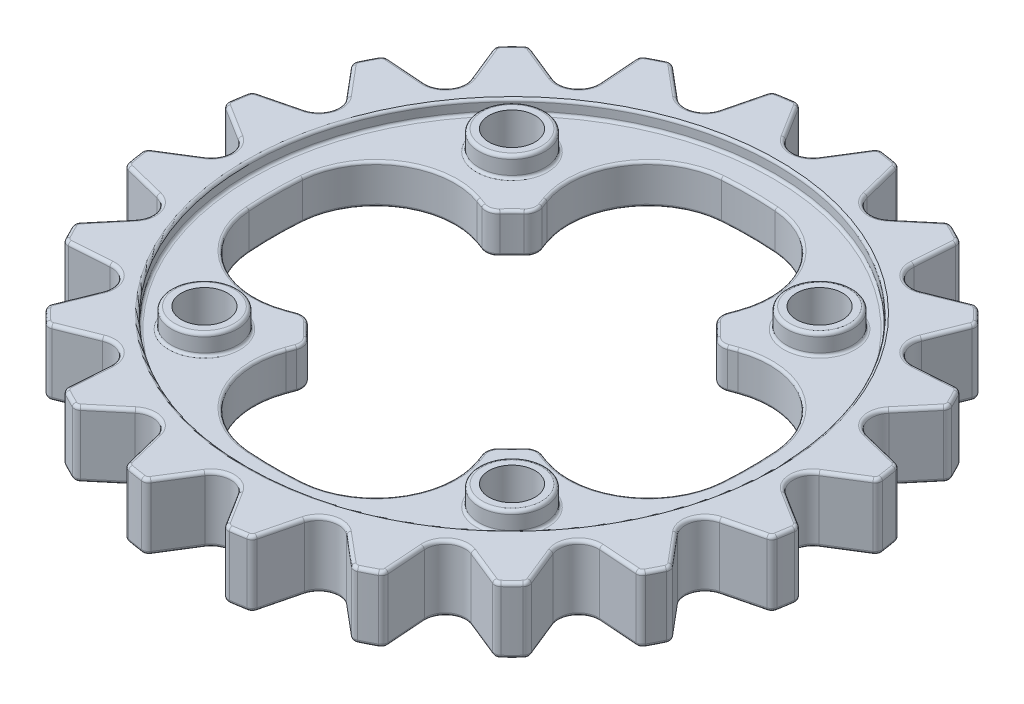
from build123d import *

# Parameters (mm, degrees)
SKETCH_1_W                       = 50
SKETCH_1_H                       = 10
CUT_REVOLVE_START                = -5
CUT_REVOLVE_1_DEPTH              = 10
FILLET_1_R                       = 1
FILLET_2_R                       = 3
PATTERN_CIRCULAR_1_COUNT         = 20
FILLET_1_OF_PATTERN_CIRCULAR_1_R = 1
FILLET_2_OF_PATTERN_CIRCULAR_1_R = 3
CUT_REVOLVE_2_DEPTH              = 10
FILLET_4_R                       = 12
PATTERN_CIRCULAR_2_COUNT         = 4
FILLET_4_OF_PATTERN_CIRCULAR_2_R = 12
SKETCH_5_W                       = 22
SKETCH_5_H                       = 10
SKETCH_8_W                       = 40
SKETCH_8_H                       = 4
SKETCH_6_W                       = 5
SKETCH_6_H                       = 12
SKETCH_7_W                       = 3.5
SKETCH_7_H                       = 12
PATTERN_CIRCULAR_3_COUNT         = 4
FILLET_5_R                       = 2
FILLET_7_R                       = 0.5
FILLET_8_R                       = 0.4


# Read off the part's stored shape, not the designer's step: Вырез-Повернуть1, Вырез-Повернуть2
with BuildPart() as part:
    # Эскиз1 → Повернуть1 (revolve)
    with BuildSketch(Plane.XY, mode=Mode.PRIVATE) as revolve_1_sk:
        with Locations((25, 0)):
            Rectangle(SKETCH_1_W, SKETCH_1_H)
    revolve(revolve_1_sk.sketch.rotate(Axis((0, -5, 0), (0, 1, 0)), 90), axis=Axis((0, -5, 0), (0, 1, 0)))

    # Вырез-Повернуть1 outline → Вырез-Повернуть1 (cut)
    with BuildSketch(Plane(origin=(0, 0, 0), x_dir=(1, 0, 0), z_dir=(0, 1, 0)).offset(CUT_REVOLVE_START)):
        with BuildLine():
            Line((-49.63611386, -6.021312223), (-40, 0))
            Line((-40, 0), (-49.63611386, 6.021312223))
            ThreePointArc((-49.63611386, 6.021312223), (-50, 0), (-49.63611386, -6.021312223))
        make_face()
    cut_revolve_1 = extrude(amount=CUT_REVOLVE_1_DEPTH, mode=Mode.SUBTRACT)

    # Скругление1
    fillet_1_edges = [part.edges().sort_by_distance(p)[0] for p in [
        (-49.63611386, 0, -6.021312223),
        (-49.63611386, 0, 6.021312223),
    ]]
    fillet(fillet_1_edges, radius=FILLET_1_R)

    # Скругление2
    fillet_2_edges = [part.edges().sort_by_distance(p)[0] for p in [
        (-40, 0, 0),
    ]]
    fillet(fillet_2_edges, radius=FILLET_2_R)

    # Круговой массив1: Вырез-Повернуть1 ×20 about axis
    pattern_circular_1_axis = Axis((0, 0, 0), (0, 1, 0))
    for i in range(1, PATTERN_CIRCULAR_1_COUNT):
        add(cut_revolve_1.rotate(pattern_circular_1_axis, i * 360 / PATTERN_CIRCULAR_1_COUNT), mode=Mode.SUBTRACT)

    # Скругление1 of Круговой массив1
    fillet_1_of_pattern_circular_1_edges = [part.edges().sort_by_distance(p)[0] for p in [
        (-49.067437335, 0, 9.611794491),
        (-45.346061725, 0, 21.065010944),
        (-43.695698172, 0, 24.304031791),
        (-36.617221123, 0, 34.046719625),
        (-34.046719625, 0, 36.617221123),
        (-24.304031791, 0, 43.695698172),
        (-21.065010944, 0, 45.346061725),
        (-9.611794491, 0, 49.067437335),
        (-6.021312223, 0, 49.63611386),
        (6.021312223, 0, 49.63611386),
        (9.611794491, 0, 49.067437335),
        (21.065010944, 0, 45.346061725),
        (24.304031791, 0, 43.695698172),
        (34.046719625, 0, 36.617221123),
        (36.617221123, 0, 34.046719625),
        (43.695698172, 0, 24.304031791),
        (45.346061725, 0, 21.065010944),
        (49.067437335, 0, 9.611794491),
        (49.63611386, 0, 6.021312223),
        (49.63611386, 0, -6.021312223),
        (49.067437335, 0, -9.611794491),
        (45.346061725, 0, -21.065010944),
        (43.695698172, 0, -24.304031791),
        (36.617221123, 0, -34.046719625),
        (34.046719625, 0, -36.617221123),
        (24.304031791, 0, -43.695698172),
        (21.065010944, 0, -45.346061725),
        (9.611794491, 0, -49.067437335),
        (6.021312223, 0, -49.63611386),
        (-6.021312223, 0, -49.63611386),
        (-9.611794491, 0, -49.067437335),
        (-21.065010944, 0, -45.346061725),
        (-24.304031791, 0, -43.695698172),
        (-34.046719625, 0, -36.617221123),
        (-36.617221123, 0, -34.046719625),
        (-43.695698172, 0, -24.304031791),
        (-45.346061725, 0, -21.065010944),
        (-49.067437335, 0, -9.611794491),
    ]]
    fillet(fillet_1_of_pattern_circular_1_edges, radius=FILLET_1_OF_PATTERN_CIRCULAR_1_R)

    # Скругление2 of Круговой массив1
    fillet_2_of_pattern_circular_1_edges = [part.edges().sort_by_distance(p)[0] for p in [
        (-38.042260652, 0, 12.360679775),
        (-32.360679775, 0, 23.511410092),
        (-23.511410092, 0, 32.360679775),
        (-12.360679775, 0, 38.042260652),
        (0, 0, 40),
        (12.360679775, 0, 38.042260652),
        (23.511410092, 0, 32.360679775),
        (32.360679775, 0, 23.511410092),
        (38.042260652, 0, 12.360679775),
        (40, 0, 0),
        (38.042260652, 0, -12.360679775),
        (32.360679775, 0, -23.511410092),
        (23.511410092, 0, -32.360679775),
        (12.360679775, 0, -38.042260652),
        (0, 0, -40),
        (-12.360679775, 0, -38.042260652),
        (-23.511410092, 0, -32.360679775),
        (-32.360679775, 0, -23.511410092),
        (-38.042260652, 0, -12.360679775),
    ]]
    fillet(fillet_2_of_pattern_circular_1_edges, radius=FILLET_2_OF_PATTERN_CIRCULAR_1_R)

    # Вырез-Повернуть2 outline → Вырез-Повернуть2 (cut)
    with BuildSketch(Plane(origin=(0, 0, 0), x_dir=(1, 0, 0), z_dir=(0, 1, 0)).offset(CUT_REVOLVE_START)):
        with BuildLine():
            Line((20, 0), (-32.622786764, 19.153128026))
            ThreePointArc((-32.622786764, 19.153128026), (-36, 0), (-32.622786764, -19.153128026))
            Line((-32.622786764, -19.153128026), (20, 0))
        make_face()
    cut_revolve_2 = extrude(amount=CUT_REVOLVE_2_DEPTH, mode=Mode.SUBTRACT)

    # Скругление4
    fillet_4_edges = [part.edges().sort_by_distance(p)[0] for p in [
        (-32.622786764, 0, -19.153128026),
        (-32.622786764, 0, 19.153128026),
    ]]
    fillet(fillet_4_edges, radius=FILLET_4_R)

    # Круговой массив2: Вырез-Повернуть2 ×4 about axis
    pattern_circular_2_axis = Axis((0, 0, 0), (0, 1, 0))
    for i in range(1, PATTERN_CIRCULAR_2_COUNT):
        add(cut_revolve_2.rotate(pattern_circular_2_axis, i * 360 / PATTERN_CIRCULAR_2_COUNT), mode=Mode.SUBTRACT)

    # Скругление4 of Круговой массив2
    fillet_4_of_pattern_circular_2_edges = [part.edges().sort_by_distance(p)[0] for p in [
        (-19.153128026, 0, 32.622786764),
        (19.153128026, 0, 32.622786764),
        (32.622786764, 0, 19.153128026),
        (32.622786764, 0, -19.153128026),
        (19.153128026, 0, -32.622786764),
        (-19.153128026, 0, -32.622786764),
    ]]
    fillet(fillet_4_of_pattern_circular_2_edges, radius=FILLET_4_OF_PATTERN_CIRCULAR_2_R)

    # Эскиз5 → Вырез-Повернуть3 (revolve, cut)
    with BuildSketch(Plane.XY):
        with Locations((11, 0)):
            Rectangle(SKETCH_5_W, SKETCH_5_H)
    revolve(axis=Axis((0, 5, 0), (0, -1, 0)), mode=Mode.SUBTRACT)

    # Эскиз8 → Вырез-Повернуть5 (revolve, cut)
    with BuildSketch(Plane.XY):
        with Locations((-20, 5)):
            Rectangle(SKETCH_8_W, SKETCH_8_H)
    cut_revolve_5 = revolve(axis=Axis((0, 7, 0), (0, -1, 0)), mode=Mode.SUBTRACT)

    # Зеркальное отражение1: Вырез-Повернуть5 across plane
    add(cut_revolve_5.mirror(Plane.ZX), mode=Mode.SUBTRACT)

    # Эскиз6 → Повернуть2 (revolve)
    with BuildSketch(Plane(origin=(0, 0, 0), x_dir=(0.7071067811865488, 0, -0.7071067811865464), z_dir=(0.7071067811865464, 0, 0.7071067811865488)), mode=Mode.PRIVATE) as revolve_2_sk:
        with Locations((35.5, 0)):
            Rectangle(SKETCH_6_W, SKETCH_6_H)
    revolve_2 = revolve(revolve_2_sk.sketch.rotate(Axis((23.334523779, -6, -23.334523779), (0, 1, 0)), 45), axis=Axis((23.334523779, -6, -23.334523779), (0, 1, 0)))

    # Эскиз7 → Вырез-Повернуть4 (revolve, cut)
    with BuildSketch(Plane(origin=(0, 0, 0), x_dir=(0.7071067811865488, 0, -0.7071067811865464), z_dir=(0.7071067811865464, 0, 0.7071067811865488)), mode=Mode.PRIVATE) as cut_revolve_4_sk:
        with Locations((34.75, 0)):
            Rectangle(SKETCH_7_W, SKETCH_7_H)
    cut_revolve_4 = revolve(cut_revolve_4_sk.sketch.rotate(Axis((23.334523779, 6, -23.334523779), (0, -1, 0)), 135), axis=Axis((23.334523779, 6, -23.334523779), (0, -1, 0)), mode=Mode.SUBTRACT)

    # Круговой массив3: Повернуть2, Вырез-Повернуть4 ×4 about axis
    pattern_circular_3_axis = Axis((0, 0, 0), (0, 1, 0))
    add([revolve_2.rotate(pattern_circular_3_axis, i * 360 / PATTERN_CIRCULAR_3_COUNT) for i in range(1, PATTERN_CIRCULAR_3_COUNT)])
    add([cut_revolve_4.rotate(pattern_circular_3_axis, i * 360 / PATTERN_CIRCULAR_3_COUNT) for i in range(1, PATTERN_CIRCULAR_3_COUNT)], mode=Mode.SUBTRACT)

    # Скругление5
    fillet_5_edges = [part.edges().sort_by_distance(p)[0] for p in [
        (-17.308985449, 0, -13.579360174),
        (-13.579360174, 0, -17.308985449),
        (13.579360174, 0, -17.308985449),
        (17.308985449, 0, -13.579360174),
        (-13.579360174, 0, 17.308985449),
        (-17.308985449, 0, 13.579360174),
        (17.308985449, 0, 13.579360174),
        (13.579360174, 0, 17.308985449),
    ]]
    fillet(fillet_5_edges, radius=FILLET_5_R)

    # Скругление7
    fillet_7_edges = [part.edges().sort_by_distance(p)[0] for p in [
        (-49.38441703, 5, -7.821723252),
        (-49.38441703, -5, -7.821723252),
        (-46.582176788, -5, 4.113000544),
        (-46.582176788, -5, -4.113000544),
        (-49.467995586, -5, -6.104585297),
        (-49.467995586, -5, 6.104585297),
        (-49.467995586, 5, -6.104585297),
        (-49.467995586, 5, 6.104585297),
        (-45.573269844, -5, -10.482988294),
        (-43.031295712, -5, -18.306380232),
        (-44.550326209, -5, -22.699524987),
        (-45.16043895, -5, -21.09225694),
        (-48.933280151, -5, -9.480645688),
        (-44.550326209, 5, -22.699524987),
        (-45.16043895, 5, -21.09225694),
        (-48.933280151, 5, -9.480645688),
        (-40.103333719, -5, -24.052829198),
        (-35.268211594, -5, -30.707803874),
        (-35.355339059, -5, -35.355339059),
        (-36.432263898, -5, -34.015271515),
        (-43.608634316, -5, -24.137845017),
        (-35.355339059, 5, -35.355339059),
        (-36.432263898, 5, -34.015271515),
        (-43.608634316, 5, -24.137845017),
        (-30.707803874, -5, -35.268211594),
        (-24.052829198, -5, -40.103333719),
        (-22.699524987, -5, -44.550326209),
        (-24.137845017, -5, -43.608634316),
        (-34.015271515, -5, -36.432263898),
        (-22.699524987, 5, -44.550326209),
        (-24.137845017, 5, -43.608634316),
        (-34.015271515, 5, -36.432263898),
        (-18.306380232, -5, -43.031295712),
        (-10.482988294, -5, -45.573269844),
        (-7.821723252, -5, -49.38441703),
        (-9.480645688, -5, -48.933280151),
        (-21.09225694, -5, -45.16043895),
        (-7.821723252, 5, -49.38441703),
        (-9.480645688, 5, -48.933280151),
        (-21.09225694, 5, -45.16043895),
        (-4.113000544, -5, -46.582176788),
        (-46.582176788, 5, -4.113000544),
        (4.113000544, -5, -46.582176788),
        (7.821723252, -5, -49.38441703),
        (6.104585297, -5, -49.467995586),
        (-6.104585297, -5, -49.467995586),
        (7.821723252, 5, -49.38441703),
        (6.104585297, 5, -49.467995586),
        (-6.104585297, 5, -49.467995586),
        (10.482988294, -5, -45.573269844),
        (18.306380232, -5, -43.031295712),
        (22.699524987, -5, -44.550326209),
        (21.09225694, -5, -45.16043895),
        (9.480645688, -5, -48.933280151),
        (-46.582176788, 5, 4.113000544),
        (22.699524987, 5, -44.550326209),
        (21.09225694, 5, -45.16043895),
        (9.480645688, 5, -48.933280151),
        (-42.661239744, 5, 0),
        (24.052829198, -5, -40.103333719),
        (30.707803874, -5, -35.268211594),
        (35.355339059, -5, -35.355339059),
        (34.015271515, -5, -36.432263898),
        (-42.661239744, -5, 0),
        (24.137845017, -5, -43.608634316),
        (35.355339059, 5, -35.355339059),
        (34.015271515, 5, -36.432263898),
        (24.137845017, 5, -43.608634316),
        (35.268211594, -5, -30.707803874),
        (40.103333719, -5, -24.052829198),
        (44.550326209, -5, -22.699524987),
        (43.608634316, -5, -24.137845017),
        (36.432263898, -5, -34.015271515),
        (44.550326209, 5, -22.699524987),
        (43.608634316, 5, -24.137845017),
        (36.432263898, 5, -34.015271515),
        (43.031295712, -5, -18.306380232),
        (45.573269844, -5, -10.482988294),
        (49.38441703, -5, -7.821723252),
        (48.933280151, -5, -9.480645688),
        (45.16043895, -5, -21.09225694),
        (49.38441703, 5, -7.821723252),
        (48.933280151, 5, -9.480645688),
        (45.16043895, 5, -21.09225694),
        (46.582176788, -5, -4.113000544),
        (46.582176788, -5, 4.113000544),
        (49.38441703, -5, 7.821723252),
        (49.467995586, -5, 6.104585297),
        (49.467995586, -5, -6.104585297),
        (49.38441703, 5, 7.821723252),
        (49.467995586, 5, 6.104585297),
        (49.467995586, 5, -6.104585297),
        (45.573269844, -5, 10.482988294),
        (43.031295712, -5, 18.306380232),
        (44.550326209, -5, 22.699524987),
        (45.16043895, -5, 21.09225694),
        (48.933280151, -5, 9.480645688),
        (44.550326209, 5, 22.699524987),
        (45.16043895, 5, 21.09225694),
        (48.933280151, 5, 9.480645688),
        (40.103333719, -5, 24.052829198),
        (35.268211594, -5, 30.707803874),
        (35.355339059, -5, 35.355339059),
        (36.432263898, -5, 34.015271515),
        (43.608634316, -5, 24.137845017),
        (35.355339059, 5, 35.355339059),
        (36.432263898, 5, 34.015271515),
        (43.608634316, 5, 24.137845017),
        (30.707803874, -5, 35.268211594),
        (24.052829198, -5, 40.103333719),
        (22.699524987, -5, 44.550326209),
        (24.137845017, -5, 43.608634316),
        (34.015271515, -5, 36.432263898),
        (22.699524987, 5, 44.550326209),
        (24.137845017, 5, 43.608634316),
        (34.015271515, 5, 36.432263898),
        (18.306380232, -5, 43.031295712),
        (10.482988294, -5, 45.573269844),
        (7.821723252, -5, 49.38441703),
        (9.480645688, -5, 48.933280151),
        (21.09225694, -5, 45.16043895),
        (7.821723252, 5, 49.38441703),
        (9.480645688, 5, 48.933280151),
        (21.09225694, 5, 45.16043895),
        (4.113000544, -5, 46.582176788),
        (-4.113000544, -5, 46.582176788),
        (-7.821723252, -5, 49.38441703),
        (-6.104585297, -5, 49.467995586),
        (6.104585297, -5, 49.467995586),
        (-7.821723252, 5, 49.38441703),
        (-6.104585297, 5, 49.467995586),
        (6.104585297, 5, 49.467995586),
        (-10.482988294, -5, 45.573269844),
        (-18.306380232, -5, 43.031295712),
        (-22.699524987, -5, 44.550326209),
        (-21.09225694, -5, 45.16043895),
        (-9.480645688, -5, 48.933280151),
        (-22.699524987, 5, 44.550326209),
        (-21.09225694, 5, 45.16043895),
        (-9.480645688, 5, 48.933280151),
        (-24.052829198, -5, 40.103333719),
        (-30.707803874, -5, 35.268211594),
        (-35.355339059, -5, 35.355339059),
        (-34.015271515, -5, 36.432263898),
        (-24.137845017, -5, 43.608634316),
        (-35.355339059, 5, 35.355339059),
        (-34.015271515, 5, 36.432263898),
        (-24.137845017, 5, 43.608634316),
        (-35.268211594, -5, 30.707803874),
        (-40.103333719, -5, 24.052829198),
        (-44.550326209, -5, 22.699524987),
        (-43.608634316, -5, 24.137845017),
        (-36.432263898, -5, 34.015271515),
        (-44.550326209, 5, 22.699524987),
        (-43.608634316, 5, 24.137845017),
        (-36.432263898, 5, 34.015271515),
        (-43.031295712, -5, 18.306380232),
        (-45.573269844, -5, 10.482988294),
        (-49.38441703, -5, 7.821723252),
        (-48.933280151, -5, 9.480645688),
        (-45.16043895, -5, 21.09225694),
        (-49.38441703, 5, 7.821723252),
        (-48.933280151, 5, 9.480645688),
        (-45.16043895, 5, 21.09225694),
        (-43.031295712, 5, -18.306380232),
        (-45.573269844, 5, -10.482988294),
        (-40.573250052, 5, -13.183048082),
        (-40.573250052, -5, -13.183048082),
        (-35.268211594, 5, -30.707803874),
        (-40.103333719, 5, -24.052829198),
        (-34.513667954, 5, -25.075647566),
        (-34.513667954, -5, -25.075647566),
        (-24.052829198, 5, -40.103333719),
        (-30.707803874, 5, -35.268211594),
        (-25.075647566, 5, -34.513667954),
        (-25.075647566, -5, -34.513667954),
        (-10.482988294, 5, -45.573269844),
        (-18.306380232, 5, -43.031295712),
        (-13.183048082, 5, -40.573250052),
        (-13.183048082, -5, -40.573250052),
        (4.113000544, 5, -46.582176788),
        (-4.113000544, 5, -46.582176788),
        (0, 5, -42.661239744),
        (0, -5, -42.661239744),
        (18.306380232, 5, -43.031295712),
        (10.482988294, 5, -45.573269844),
        (13.183048082, 5, -40.573250052),
        (13.183048082, -5, -40.573250052),
        (30.707803874, 5, -35.268211594),
        (24.052829198, 5, -40.103333719),
        (25.075647566, 5, -34.513667954),
        (25.075647566, -5, -34.513667954),
        (40.103333719, 5, -24.052829198),
        (35.268211594, 5, -30.707803874),
        (34.513667954, 5, -25.075647566),
        (34.513667954, -5, -25.075647566),
        (45.573269844, 5, -10.482988294),
        (43.031295712, 5, -18.306380232),
        (40.573250052, 5, -13.183048082),
        (40.573250052, -5, -13.183048082),
        (46.582176788, 5, 4.113000544),
        (46.582176788, 5, -4.113000544),
        (42.661239744, 5, 0),
        (42.661239744, -5, 0),
        (43.031295712, 5, 18.306380232),
        (45.573269844, 5, 10.482988294),
        (40.573250052, 5, 13.183048082),
        (40.573250052, -5, 13.183048082),
        (35.268211594, 5, 30.707803874),
        (40.103333719, 5, 24.052829198),
        (34.513667954, 5, 25.075647566),
        (34.513667954, -5, 25.075647566),
        (24.052829198, 5, 40.103333719),
        (30.707803874, 5, 35.268211594),
        (25.075647566, 5, 34.513667954),
        (25.075647566, -5, 34.513667954),
        (10.482988294, 5, 45.573269844),
        (18.306380232, 5, 43.031295712),
        (13.183048082, 5, 40.573250052),
        (13.183048082, -5, 40.573250052),
        (-4.113000544, 5, 46.582176788),
        (4.113000544, 5, 46.582176788),
        (0, 5, 42.661239744),
        (0, -5, 42.661239744),
        (-18.306380232, 5, 43.031295712),
        (-10.482988294, 5, 45.573269844),
        (-13.183048082, 5, 40.573250052),
        (-13.183048082, -5, 40.573250052),
        (-30.707803874, 5, 35.268211594),
        (-24.052829198, 5, 40.103333719),
        (-25.075647566, 5, 34.513667954),
        (-25.075647566, -5, 34.513667954),
        (-40.103333719, 5, 24.052829198),
        (-35.268211594, 5, 30.707803874),
        (-34.513667954, 5, 25.075647566),
        (-34.513667954, -5, 25.075647566),
        (-45.573269844, 5, 10.482988294),
        (-43.031295712, 5, 18.306380232),
        (-40.573250052, 5, 13.183048082),
        (-40.573250052, -5, 13.183048082),
        (23.334523779, 6, -18.334523779),
        (23.334523779, -6, -18.334523779),
        (18.334523779, 6, 23.334523779),
        (18.334523779, -6, 23.334523779),
        (-23.334523779, 6, 18.334523779),
        (-23.334523779, -6, 18.334523779),
        (-18.334523779, 6, -23.334523779),
        (-18.334523779, -6, -23.334523779),
    ]]
    fillet(fillet_7_edges, radius=FILLET_7_R)

    # Скругление8
    fillet_8_edges = [part.edges().sort_by_distance(p)[0] for p in [
        (40, 5, 0),
        (19.203207892, 3, 14.26880076),
        (-14.26880076, 3, 19.203207892),
        (-19.203207892, 3, -14.26880076),
        (14.26880076, 3, -19.203207892),
        (30.403763248, 3, 13.276016353),
        (36, 3, 0),
        (30.403763248, 3, -13.276016353),
        (19.203207892, 3, -14.26880076),
        (13.276016353, 3, -30.403763248),
        (0, 3, -36),
        (-13.276016353, 3, -30.403763248),
        (-14.26880076, 3, -19.203207892),
        (-30.403763248, 3, -13.276016353),
        (-36, 3, 0),
        (-30.403763248, 3, 13.276016353),
        (-19.203207892, 3, 14.26880076),
        (-13.276016353, 3, 30.403763248),
        (0, 3, 36),
        (13.276016353, 3, 30.403763248),
        (14.26880076, 3, 19.203207892),
        (40, 3, 0),
        (40, -5, 0),
        (13.276016353, -3, 30.403763248),
        (0, -3, 36),
        (-13.276016353, -3, 30.403763248),
        (-30.403763248, -3, 13.276016353),
        (-36, -3, 0),
        (-30.403763248, -3, -13.276016353),
        (-13.276016353, -3, -30.403763248),
        (0, -3, -36),
        (13.276016353, -3, -30.403763248),
        (30.403763248, -3, -13.276016353),
        (36, -3, 0),
        (30.403763248, -3, 13.276016353),
        (40, -3, 0),
        (23.334523779, 3, -18.334523779),
        (23.334523779, -3, -18.334523779),
        (18.334523779, 3, 23.334523779),
        (18.334523779, -3, 23.334523779),
        (-23.334523779, 3, 18.334523779),
        (-23.334523779, -3, 18.334523779),
        (-18.334523779, 3, -23.334523779),
        (-18.334523779, -3, -23.334523779),
        (-19.203207892, -3, -14.26880076),
        (15.556349186, 3, 15.556349186),
        (-15.556349186, 3, 15.556349186),
        (-15.556349186, 3, -15.556349186),
        (15.556349186, 3, -15.556349186),
        (-13.99963268, 3, 17.452908197),
        (-13.99963268, 3, -17.452908197),
        (17.452908197, 3, -13.99963268),
        (13.99963268, 3, -17.452908197),
        (17.452908197, 3, 13.99963268),
        (13.99963268, 3, 17.452908197),
        (-17.452908197, 3, 13.99963268),
        (-17.452908197, 3, -13.99963268),
        (-15.556349186, -3, -15.556349186),
        (15.556349186, -3, 15.556349186),
        (19.203207892, -3, 14.26880076),
        (19.203207892, -3, -14.26880076),
        (15.556349186, -3, -15.556349186),
        (14.26880076, -3, -19.203207892),
        (-14.26880076, -3, -19.203207892),
        (-19.203207892, -3, 14.26880076),
        (-15.556349186, -3, 15.556349186),
        (-14.26880076, -3, 19.203207892),
        (14.26880076, -3, 19.203207892),
        (-13.99963268, -3, 17.452908197),
        (-13.99963268, -3, -17.452908197),
        (17.452908197, -3, -13.99963268),
        (13.99963268, -3, -17.452908197),
        (17.452908197, -3, 13.99963268),
        (13.99963268, -3, 17.452908197),
        (-17.452908197, -3, 13.99963268),
        (-17.452908197, -3, -13.99963268),
    ]]
    fillet(fillet_8_edges, radius=FILLET_8_R)


solid = part.part
